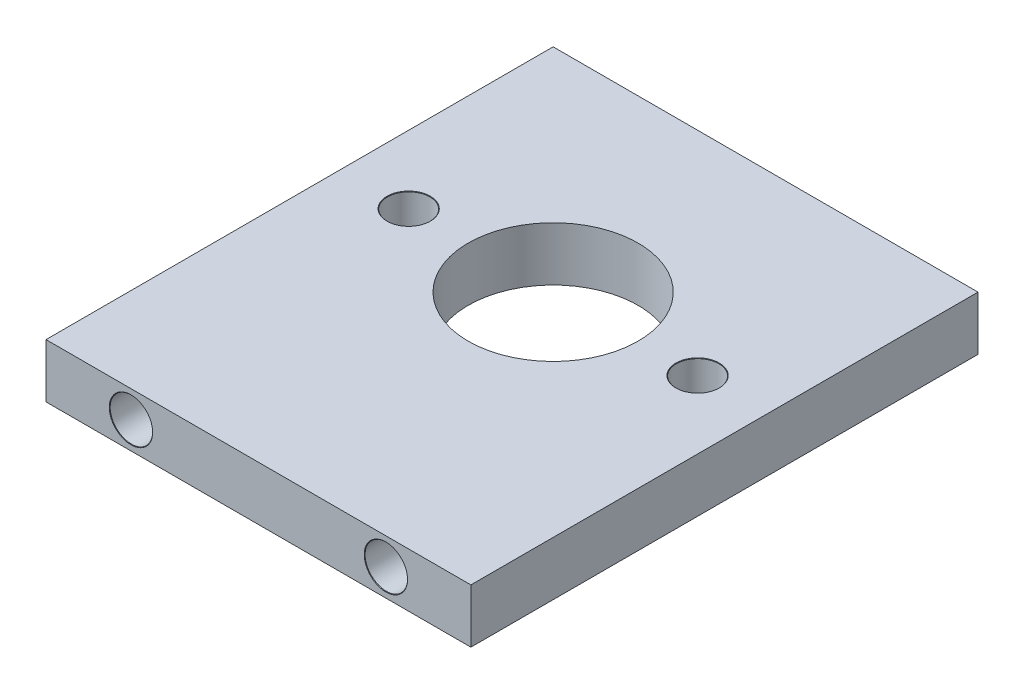
from build123d import *

# Parameters (mm, degrees)
BOSS_EXTRUDE1_DEPTH                   = 3.175
TAP_DRILL_FOR_M3X0_5_TAP1_D           = 2.5
TAP_DRILL_FOR_M3X0_5_TAP1_CSINK_D     = 2.55
TAP_DRILL_FOR_M3X0_5_TAP1_CSINK_ANGLE = 90
TAP_DRILL_FOR_M3X0_5_TAP2_D           = 2.5
TAP_DRILL_FOR_M3X0_5_TAP2_DEPTH       = 12
TAP_DRILL_FOR_M3X0_5_TAP2_CSINK_D     = 2.55
TAP_DRILL_FOR_M3X0_5_TAP2_CSINK_ANGLE = 90
TAP_DRILL_FOR_M3X0_5_TAP2_TIP         = 0.751075774
CUT_EXTRUDE1_REACH                    = 23.61
SKETCH8_R                             = 5


with BuildPart() as part:
    # Sketch1 → Boss-Extrude1 (new body)
    with BuildSketch(Plane(origin=(0, 0, 0), x_dir=(1, 0, 0), z_dir=(0, 1, 0))):
        Polygon((-12.5, -12.5), (-12.5, -17.34), (12.5, -17.34), (12.5, -12.5), (12.5, 12.5), (-12.5, 12.5), align=None)
    extrude(amount=BOSS_EXTRUDE1_DEPTH)

    # Tap Drill for M3x0.5 Tap1 (through all)
    with Locations(Plane(origin=(0, 3.175, 0), x_dir=(1, 0, 0), z_dir=(0, 1, 0))):
        with Locations((-8.5, 0), (8.5, 0)):
            CounterSinkHole(TAP_DRILL_FOR_M3X0_5_TAP1_D / 2, TAP_DRILL_FOR_M3X0_5_TAP1_CSINK_D / 2, counter_sink_angle=TAP_DRILL_FOR_M3X0_5_TAP1_CSINK_ANGLE)

    # Tap Drill for M3x0.5 Tap2
    with Locations(Plane.XY.offset(17.34)):
        with Locations((-7.5, 1.5875), (7.5, 1.5875)):
            CounterSinkHole(TAP_DRILL_FOR_M3X0_5_TAP2_D / 2, TAP_DRILL_FOR_M3X0_5_TAP2_CSINK_D / 2, depth=TAP_DRILL_FOR_M3X0_5_TAP2_DEPTH, counter_sink_angle=TAP_DRILL_FOR_M3X0_5_TAP2_CSINK_ANGLE)
            with Locations((0, 0, -(TAP_DRILL_FOR_M3X0_5_TAP2_DEPTH + TAP_DRILL_FOR_M3X0_5_TAP2_TIP / 2))):  # 118° drill point
                Cone(0, TAP_DRILL_FOR_M3X0_5_TAP2_D / 2, TAP_DRILL_FOR_M3X0_5_TAP2_TIP, mode=Mode.SUBTRACT)

    # Sketch8 → Cut-Extrude1 (cut, up to next)
    with BuildSketch(Plane(origin=(0, 3.175, 0), x_dir=(1, 0, 0), z_dir=(0, 1, 0)), mode=Mode.PRIVATE) as cut_extrude1_sk1:
        Circle(SKETCH8_R)
    cut_extrude1_tool1 = extrude(cut_extrude1_sk1.sketch, amount=-CUT_EXTRUDE1_REACH, mode=Mode.PRIVATE) & part.part
    add(cut_extrude1_tool1.solids().sort_by_distance((0, 3.175, 0))[0], mode=Mode.SUBTRACT)


solid = part.part
